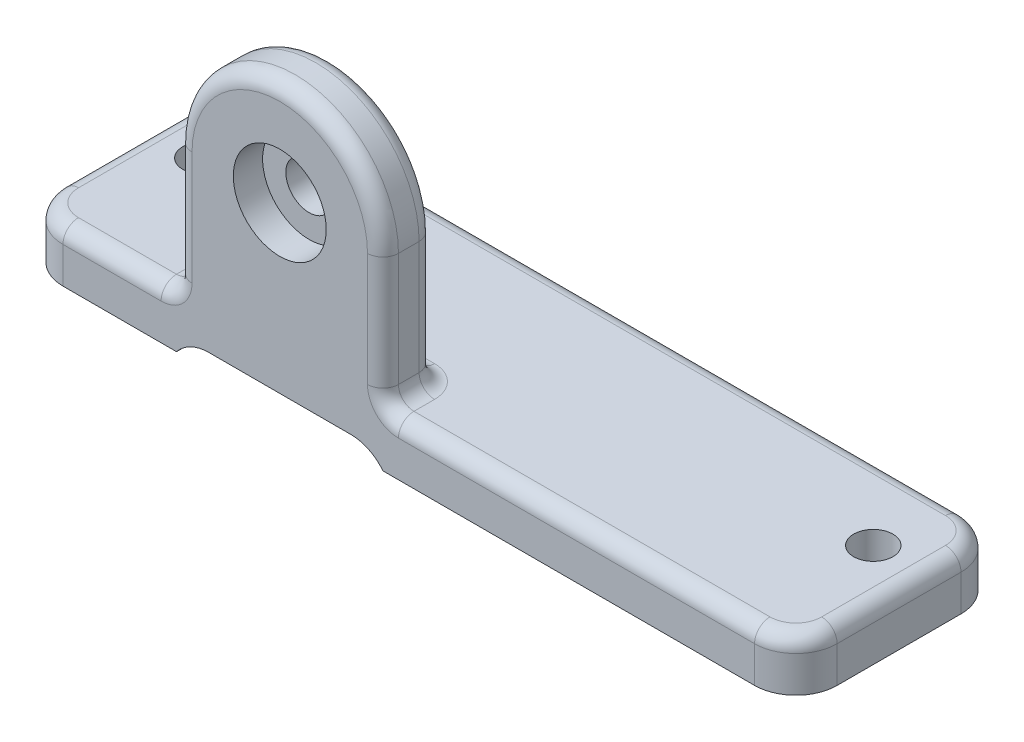
from build123d import *

# Parameters (mm, degrees)
CROQUIS1_W                                           = 150
CROQUIS1_H                                           = 40
SALIENTE_EXTRUIR1_DEPTH                              = 10
SALIENTE_EXTRUIR2_DEPTH                              = 10
CROQUIS3_W                                           = 40
CROQUIS3_H                                           = 3
CORTAR_EXTRUIR1_DEPTH                                = 165.69669092
REFRENTADO_PARA_PERNO_CON_CABEZA_HEXAGON_D           = 9
REFRENTADO_PARA_PERNO_CON_CABEZA_HEXAGON_CBORE_D     = 18.01
REFRENTADO_PARA_PERNO_CON_CABEZA_HEXAGON_CBORE_DEPTH = 5.68
REDONDEO1_R                                          = 8
REDONDEO2_R                                          = 8
REDONDEO3_R                                          = 3
TALADRO_DE_MARGEN_PARA_M71_D                         = 7.6


with BuildPart() as part:
    # Croquis1 → Saliente-Extruir1 (new body)
    with BuildSketch(Plane(origin=(0, 0, 0), x_dir=(1, 0, 0), z_dir=(0, 1, 0))):
        with Locations((75, 20)):
            Rectangle(CROQUIS1_W, CROQUIS1_H)
    extrude(amount=SALIENTE_EXTRUIR1_DEPTH)

    # Croquis2 → Saliente-Extruir2 (add)
    with BuildSketch(Plane.XY):
        with BuildLine():
            Line((30, 0), (30, 35))
            ThreePointArc((30, 35), (50, 55), (70, 35))
            Line((70, 35), (70, 0))
            Line((70, 0), (30, 0))
        make_face()
    extrude(amount=-SALIENTE_EXTRUIR2_DEPTH)

    # Croquis3 → Cortar-Extruir1 (cut, through all)
    with BuildSketch(Plane.XY):
        with Locations((50, 1.5)):
            Rectangle(CROQUIS3_W, CROQUIS3_H)
    extrude(amount=-CORTAR_EXTRUIR1_DEPTH, mode=Mode.SUBTRACT)

    # Refrentado para perno con cabeza hexagonal de M81 (through all)
    with Locations(Plane.XY):
        with Locations((50, 35)):
            CounterBoreHole(REFRENTADO_PARA_PERNO_CON_CABEZA_HEXAGON_D / 2, REFRENTADO_PARA_PERNO_CON_CABEZA_HEXAGON_CBORE_D / 2, REFRENTADO_PARA_PERNO_CON_CABEZA_HEXAGON_CBORE_DEPTH)

    # Redondeo1
    # the kernel refuses this fillet: 8 mm, written as the material it adds along each edge
    with BuildSketch(Plane(origin=(70, 3, 0), x_dir=(-1, 0, 0), z_dir=(0, 0, -1))) as redondeo1_piece_1:
        with BuildLine():
            CenterArc((6.244997998, -8), REDONDEO1_R, 90, 51.317812547)
            Line((0, -3), (-0.12489996, -2.9))
            ThreePointArc((-0.12489996, -2.9), (-0.16, -1.5), (-0.16, 0))
            Line((-0.16, 0), (0, 0.16))
            Line((0, 0.16), (6.244997998, 0.16))
            Line((6.244997998, 0.16), (6.244997998, 0))
        make_face()
    extrude(amount=40)
    with BuildSketch(Plane(origin=(30, 3, 0), x_dir=(0, -1, 0), z_dir=(0, 0, -1))) as redondeo1_piece_2:
        with BuildLine():
            CenterArc((8, -6.244997998), REDONDEO1_R, 128.682187453, 51.317812547)
            Line((0, -6.244997998), (-0.16, -6.244997998))
            Line((-0.16, -6.244997998), (-0.16, 0))
            Line((-0.16, 0), (0, 0.16))
            ThreePointArc((0, 0.16), (1.5, 0.16), (2.9, 0.12489996))
            Line((2.9, 0.12489996), (3, 0))
        make_face()
    extrude(amount=40)

    # Redondeo2
    redondeo2_edges = [part.edges().sort_by_distance(p)[0] for p in [
        (0, 5, -40),
        (0, 5, 0),
        (150, 5, 0),
        (150, 5, -40),
    ]]
    fillet(redondeo2_edges, radius=REDONDEO2_R)

    # Redondeo3
    redondeo3_edges = [part.edges().sort_by_distance(p)[0] for p in [
        (106, 10, 0),
        (30, 22.5, -10),
        (30, 10, -5),
        (50, 55, -10),
        (70, 10, -5),
        (70, 22.5, -10),
        (50, 10, -10),
        (70, 22.5, 0),
        (50, 55, 0),
        (30, 22.5, 0),
        (150, 10, -20),
        (19, 10, 0),
        (75, 10, -40),
        (0, 10, -20),
        (2.343145751, 10, -2.343145751),
        (2.343145751, 10, -37.656854249),
        (147.656854249, 10, -37.656854249),
        (147.656854249, 10, -2.343145751),
    ]]
    fillet(redondeo3_edges, radius=REDONDEO3_R)

    # Taladro de margen para M71 (through all)
    with Locations(Plane(origin=(0, 10, 0), x_dir=(1, 0, 0), z_dir=(0, 1, 0))):
        with Locations((140, 25), (10, 25)):
            Hole(TALADRO_DE_MARGEN_PARA_M71_D / 2)


solid = part.part
